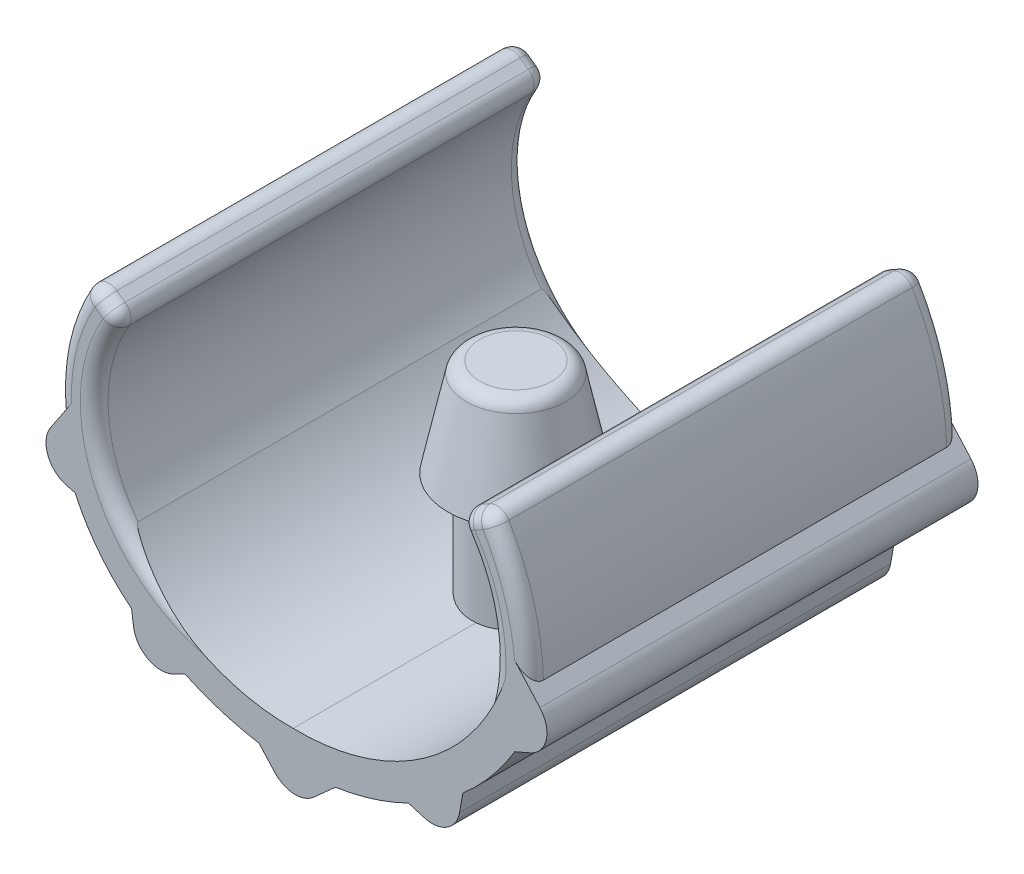
from build123d import *

# Parameters (mm, degrees)
BOSS_EXTRUDE2_DEPTH      = 438
SCALE2_SCALE             = 0.0354
FILLET1_R                = 1
FILLET3_R                = 0.5
BOSS_EXTRUDE4_REACH      = 229.046
BOSS_EXTRUDE4_END_RADIUS = 7.833804903539409
BOSS_EXTRUDE5_REACH      = 229.046
BOSS_EXTRUDE5_END_RADIUS = 7.195916772354179
SKETCH9_R                = 2.4500000000000166
BOSS_EXTRUDE6_DEPTH      = 3.5
BOSS_EXTRUDE6_TAPER      = 12.000000000000027
FILLET4_R                = 0.5
FILLET5_R                = 0.5


with BuildPart() as part:
    # Sketch1 → Boss-Extrude2 (new body)
    with BuildSketch(Plane.XY):
        with BuildLine():
            Line((-173.94944488422587, 133.04893483641976), (-205.55757114517837, 155.72039241042245))
            ThreePointArc((-205.55757114517837, 155.72039241042245), (-234.14291759319866, 90.65435185474743), (-237.99856948063464, 19.690659633520692))
            Line((-237.99856948063464, 19.690659633520692), (-268.78560446228477, -26.37000218418542))
            Line((-268.78560446228477, -26.37000218418542), (-221.58334196654945, -38.0173137091073))
            ThreePointArc((-221.58334196654945, -38.0173137091073), (-197.25445069634355, -77.98900365041848), (-164.25104188106897, -111.16137097284042))
            Line((-164.25104188106897, -111.16137097284042), (-156.91020046510585, -164.92082999803867))
            Line((-156.91020046510585, -164.92082999803867), (-109.83694304552782, -141.76430329216726))
            ThreePointArc((-109.83694304552782, -141.76430329216726), (-73.05463931342217, -155.90344513018698), (-34.693982777046784, -164.92082999802741))
            Line((-34.693982777046784, -164.92082999802741), (8.7e-16, -203.32876962147174))
            Line((8.7e-16, -203.32876962147174), (42.886528299507454, -164.92082999803867))
            ThreePointArc((42.886528299507454, -164.92082999803867), (80.85031694587045, -156.15581480317226), (117.0574866250999, -141.76430329216527))
            Line((117.0574866250999, -141.76430329216527), (163.62663007317934, -155.5211020358426))
            Line((163.62663007317934, -155.5211020358426), (172.33489452773424, -105.31526123343045))
            ThreePointArc((172.33489452773424, -105.31526123343045), (201.26999586949904, -76.00180070121596), (225.16207447857465, -42.45053190598781))
            Line((225.16207447857465, -42.45053190598781), (276.7091620785597, -20.09552082246478))
            Line((276.7091620785597, -20.09552082246478), (240.13220907166487, 20.928394745859066))
            ThreePointArc((240.13220907166487, 20.928394745859066), (228.50333628815278, 91.31530648405399), (197.81892765652609, 155.72039241042245))
            Line((197.81892765652609, 155.72039241042245), (163.62663007317934, 136.78068958284211))
            ThreePointArc((163.62663007317934, 136.78068958284211), (200.40161641541866, 53.04108317489744), (188.74891280313733, -37.672398735751855))
            ThreePointArc((188.74891280313733, -37.672398735751855), (106.72957881975618, -110.16481840277211), (0, -134.4777586037073))
            ThreePointArc((0, -134.4777586037073), (-97.14653243858214, -111.81017845437619), (-171.81116977095917, -45.655360892149815))
            ThreePointArc((-171.81116977095917, -45.655360892149815), (-202.2026421094417, 43.34593240273995), (-173.94944488422587, 133.04893483641976))
        make_face()
    extrude(amount=BOSS_EXTRUDE2_DEPTH)


with BuildPart() as part_1:
    # Scale2: scaled about (-0.803531763, -44.538090577, 219)
    add(part.part.scale(SCALE2_SCALE).moved(Location((-0.7750867385897999, -42.9614421705742, 211.2474))))

    # Fillet1
    fillet1_edges = [part_1.edges().sort_by_distance(p)[0] for p in [
        (9.020417598991212, -43.67282360768945, 219),
        (5.017295966000749, -48.46688918264303, 219),
        (-0.7750867385897999, -50.1592806151743, 219),
        (-6.329707835054547, -48.79963955250477, 219),
        (-10.290097136554682, -43.89494024789437, 219),
    ]]
    fillet(fillet1_edges, radius=FILLET1_R)

    # Fillet3
    fillet3_edges = [part_1.edges().sort_by_distance(p)[0] for p in [
        (5.017295966000749, -38.11940575934159, 219),
        (6.227703300451223, -37.44894027924525, 219),
        (-8.051824757129115, -37.44894027924525, 219),
        (-6.932897087491397, -38.25150987736494, 219),
    ]]
    fillet(fillet3_edges, radius=FILLET3_R)

    # Boss-Extrude4: up to this cylinder (the profile starts inside it)
    boss_extrude4_end = Plane(origin=(-0.5718782122733226, -39.8907859748304, 218.5826), z_dir=(0, 0, -1)) * Cylinder(BOSS_EXTRUDE4_END_RADIUS, 474.7596098070788, mode=Mode.PRIVATE)
    # Sketch5 → Boss-Extrude4 (add, up to the surface)
    with BuildSketch(Plane(origin=(4.93e-15, -43.92195482510527, 0), x_dir=(-1, 0, 0), z_dir=(0, -1, 0)), mode=Mode.PRIVATE) as boss_extrude4_sk1:
        with BuildLine():
            Line((2.4830433835215895, -218.9766325943123), (2.4830433835215895, -218.18856740568762))
            ThreePointArc((2.4830433835215895, -218.18856740568762), (-0.6676784853573625, -218.58259999999996), (2.4830433835215895, -218.9766325943123))
        make_face()
    boss_extrude4_tool1 = extrude(boss_extrude4_sk1.sketch, amount=BOSS_EXTRUDE4_REACH, mode=Mode.PRIVATE) & boss_extrude4_end
    add(boss_extrude4_tool1.solids().sort_by_distance((-0.927234, -43.921955, 218.5826))[0])

    # Boss-Extrude5: up to this cylinder (the profile starts inside it)
    boss_extrude5_end = Plane(origin=(-0.909438988805693, -40.527292382187355, 218.5826), z_dir=(0, 0, -1)) * Cylinder(BOSS_EXTRUDE5_END_RADIUS, 473.4838335447083, mode=Mode.PRIVATE)
    # Sketch8 → Boss-Extrude5 (add, up to the surface)
    with BuildSketch(Plane(origin=(4.93e-15, -43.92195482510527, 0), x_dir=(-1, 0, 0), z_dir=(0, -1, 0)), mode=Mode.PRIVATE) as boss_extrude5_sk1:
        with BuildLine():
            Line((0.9323215146426276, -216.9826), (0.9323215146426278, -220.18259999999995))
            ThreePointArc((0.9323215146426278, -220.18259999999995), (2.5323215146426223, -218.58259999999996), (0.9323215146426276, -216.9826))
        make_face()
    boss_extrude5_tool1 = extrude(boss_extrude5_sk1.sketch, amount=BOSS_EXTRUDE5_REACH, mode=Mode.PRIVATE) & boss_extrude5_end
    add(boss_extrude5_tool1.solids().sort_by_distance((-1.611383, -43.921955, 218.5826))[0])

    # Sketch9 → Boss-Extrude6 (add)
    with BuildSketch(Plane(origin=(0, -43.92195482510527, 0), x_dir=(1, 0, 0), z_dir=(0, 1, 0))):
        with Locations((-0.9323215146426234, -218.58259999999996)):
            Circle(SKETCH9_R)
    extrude(amount=BOSS_EXTRUDE6_DEPTH, taper=BOSS_EXTRUDE6_TAPER)

    # Fillet4
    fillet4_edges = [part_1.edges().sort_by_distance(p)[0] for p in [
        (-2.63837354879756, -40.42195482510527, 218.58259999999996),
    ]]
    fillet(fillet4_edges, radius=FILLET4_R)

    # Fillet5
    # the kernel refuses this fillet: 0.5 mm, written as the material it takes off along each edge
    with BuildSketch(Plane(origin=(-7.3217616019139315, -37.97259029611609, 226.75259999999997), x_dir=(-0.5828410448445791, -0.8125861901635294, 0), z_dir=(-0.8125861901635294, 0.5828410448445791, 0))) as fillet5_piece_1:
        with BuildLine():
            CenterArc((FILLET5_R, -FILLET5_R), FILLET5_R, 90, 90)
            Line((-1.04e-15, -FILLET5_R), (0, 0))
            Line((0, 0), (FILLET5_R, 0))
        make_face()
    extrude(amount=0.3636755048877642, mode=Mode.SUBTRACT)
    with BuildSketch(Plane(origin=(-2.222841997345296, -41.383728471589215, 211.2474), x_dir=(-0.8703618288951374, 0.4924127199842747, 0), z_dir=(0.4924127199842747, 0.8703618288951374, 0))) as fillet5_piece_2_section:
        with BuildLine():
            CenterArc((7.032751817920667 - FILLET5_R, FILLET5_R), FILLET5_R, 270, 90)
            Line((7.03275181792067, FILLET5_R), (7.032751817920667, 0))
            Line((7.032751817920667, 0), (7.032751817920667 - FILLET5_R, 0))
        make_face()
    fillet5_piece_2 = revolve(axis=Axis((-2.222841997345296, -41.383728471589215, 211.2474), (0, 0, 1)), revolution_arc=46.87735831294304, mode=Mode.PRIVATE)
    fillet5_piece_2 = split(fillet5_piece_2, bisect_by=Plane(origin=(-6.638744674472937, -38.43213062581033, 211.2474), z_dir=(-0.8313838495271342, 0.555698564642238, 0)), keep=Keep.TOP, mode=Mode.PRIVATE)
    add(fillet5_piece_2, mode=Mode.SUBTRACT)
    with BuildSketch(Plane(origin=(0.32885461555361095, -41.94642319372326, 211.2474), x_dir=(0.8287837428916393, 0.5595690373122207, 0), z_dir=(-0.5595690373122207, 0.8287837428916393, 0))) as fillet5_piece_3_section:
        with BuildLine():
            CenterArc((6.0520694592547315 + FILLET5_R, -FILLET5_R), FILLET5_R, 90, 90)
            Line((6.0520694592547315, -FILLET5_R), (6.0520694592547315, 0))
            Line((6.0520694592547315, 0), (6.0520694592547315 + FILLET5_R, 0))
        make_face()
    fillet5_piece_3 = revolve(axis=Axis((0.32885461555361095, -41.94642319372326, 211.2474), (0, 0, -1)), revolution_arc=68.69623330129464, mode=Mode.PRIVATE)
    fillet5_piece_3 = fillet5_piece_3 & Plane(origin=(-0.5718782121867003, -39.89078597487058, 211.2474), x_dir=(0.8269931491274296, -0.5622119985346248, 0), z_dir=(0, 0, -1)) * Cylinder(7.833804903539417, 27, mode=Mode.PRIVATE)
    add(fillet5_piece_3, mode=Mode.SUBTRACT)
    with BuildSketch(Plane(origin=(5.8127153150509905, -37.67880927536456, 211.2474), x_dir=(0.4845474084832911, -0.8747650021189273, 0), z_dir=(-0.8747650021189273, -0.48454740848329114, 0))) as fillet5_piece_4:
        with BuildLine():
            CenterArc((FILLET5_R, FILLET5_R), FILLET5_R, 180, 90)
            Line((-5.79e-15, FILLET5_R), (0, 0))
            Line((0, 0), (FILLET5_R, 0))
        make_face()
    extrude(amount=0.3382459893744765, mode=Mode.SUBTRACT)
    with BuildSketch(Plane(origin=(6.054989019292634, -38.116191776424024, 211.2474), x_dir=(-0.48454740848328376, 0.8747650021189313, 0), z_dir=(-0.8747650021189313, -0.48454740848328376, 0))) as fillet5_piece_5:
        with BuildLine():
            CenterArc((0.5000000000000022 - FILLET5_R, -FILLET5_R), FILLET5_R, 0, 90)
            Line((0.49999999999999734, -FILLET5_R), (0.5000000000000022, 0))
            Line((0.5000000000000022, 0), (0.5000000000000022 - FILLET5_R, 0))
        make_face()
    revolve(axis=Axis((6.054989019292634, -38.116191776424024, 211.2474), (0, 0, -1)), revolution_arc=88.56241548700423, mode=Mode.SUBTRACT)
    with BuildSketch(Plane(origin=(5.759103265680751, -38.2800879940053, 211.2474), x_dir=(-0.8287837428916521, -0.5595690373122013, 0), z_dir=(0.5595690373122013, -0.8287837428916521, 0))) as fillet5_piece_6:
        with BuildLine():
            CenterArc((0.5000000000000004 - FILLET5_R, -FILLET5_R), FILLET5_R, 0, 90)
            Line((0.5000000000000012, -FILLET5_R), (0.5000000000000004, 0))
            Line((0.5000000000000004, 0), (0.5000000000000004 - FILLET5_R, 0))
        make_face()
    revolve(axis=Axis((5.759103265680751, -38.2800879940053, 211.2474), (0, 0, -1)), revolution_arc=95.04317493858562, mode=Mode.SUBTRACT)
    with BuildSketch(Plane(origin=(-7.908699817308769, -38.16691837994469, 211.2474), x_dir=(-0.8703618288951306, 0.4924127199842868, 0), z_dir=(-0.4924127199842868, -0.8703618288951306, 0))) as fillet5_piece_7:
        with BuildLine():
            CenterArc((0.5000000000000004 - FILLET5_R, -FILLET5_R), FILLET5_R, 0, 90)
            Line((0.5000000000000039, -FILLET5_R), (0.5000000000000004, 0))
            Line((0.5000000000000004, 0), (0.5000000000000004 - FILLET5_R, 0))
        make_face()
    revolve(axis=Axis((-7.908699817308769, -38.16691837994469, 211.2474), (0, 0, -1)), revolution_arc=96.15132931169192, mode=Mode.SUBTRACT)
    with BuildSketch(Plane(origin=(-7.613182124336225, -38.37888339119785, 211.2474), x_dir=(0.5828410448445934, 0.812586190163519, 0), z_dir=(-0.812586190163519, 0.5828410448445934, 0))) as fillet5_piece_8:
        with BuildLine():
            CenterArc((0.4999999999999974 - FILLET5_R, -FILLET5_R), FILLET5_R, 0, 90)
            Line((0.4999999999999974, -FILLET5_R), (0.4999999999999974, 0))
            Line((0.4999999999999974, 0), (0.4999999999999974 - FILLET5_R, 0))
        make_face()
    revolve(axis=Axis((-7.613182124336225, -38.37888339119785, 211.2474), (0, 0, -1)), revolution_arc=85.08742679291215, mode=Mode.SUBTRACT)
    with BuildSketch(Plane(origin=(5.8127153150509905, -37.67880927536456, 226.75259999999997), x_dir=(0.4845474084832911, -0.8747650021189273, 0), z_dir=(-0.8747650021189273, -0.48454740848329114, 0))) as fillet5_piece_9:
        with BuildLine():
            CenterArc((FILLET5_R, -FILLET5_R), FILLET5_R, 90, 90)
            Line((-5.79e-15, -FILLET5_R), (0, 0))
            Line((0, 0), (FILLET5_R, 0))
        make_face()
    extrude(amount=0.3382459893744765, mode=Mode.SUBTRACT)
    with BuildSketch(Plane(origin=(0.32885461555361095, -41.94642319372326, 226.75259999999997), x_dir=(0.8287837428916393, 0.5595690373122207, 0), z_dir=(-0.5595690373122207, 0.8287837428916393, 0))) as fillet5_piece_10_section:
        with BuildLine():
            CenterArc((6.0520694592547315 + FILLET5_R, FILLET5_R), FILLET5_R, 180, 90)
            Line((6.052069459254732, FILLET5_R), (6.0520694592547315, 0))
            Line((6.0520694592547315, 0), (6.0520694592547315 + FILLET5_R, 0))
        make_face()
    fillet5_piece_10 = revolve(axis=Axis((0.32885461555361095, -41.94642319372326, 226.75259999999997), (0, 0, -1)), revolution_arc=68.6962333012946, mode=Mode.PRIVATE)
    fillet5_piece_10 = fillet5_piece_10 & Plane(origin=(-0.5718782121867003, -39.89078597487058, 226.75259999999997), x_dir=(0.8269931491274296, -0.5622119985346248, 0), z_dir=(0, 0, -1)) * Cylinder(7.833804903539417, 27, mode=Mode.PRIVATE)
    add(fillet5_piece_10, mode=Mode.SUBTRACT)
    with BuildSketch(Plane(origin=(-2.222841997345296, -41.383728471589215, 226.75259999999997), x_dir=(-0.8703618288951374, 0.4924127199842747, 0), z_dir=(0.4924127199842747, 0.8703618288951374, 0))) as fillet5_piece_11_section:
        with BuildLine():
            CenterArc((7.032751817920667 - FILLET5_R, -FILLET5_R), FILLET5_R, 0, 90)
            Line((7.03275181792067, -FILLET5_R), (7.032751817920667, 0))
            Line((7.032751817920667, 0), (7.032751817920667 - FILLET5_R, 0))
        make_face()
    fillet5_piece_11 = revolve(axis=Axis((-2.222841997345296, -41.383728471589215, 226.75259999999997), (0, 0, 1)), revolution_arc=46.87735831294304, mode=Mode.PRIVATE)
    fillet5_piece_11 = split(fillet5_piece_11, bisect_by=Plane(origin=(-6.638744674472937, -38.43213062581033, 226.75259999999997), z_dir=(-0.8313838495271342, 0.555698564642238, 0)), keep=Keep.TOP, mode=Mode.PRIVATE)
    add(fillet5_piece_11, mode=Mode.SUBTRACT)
    with BuildSketch(Plane(origin=(6.054989019292634, -38.116191776424024, 226.75259999999997), x_dir=(-0.48454740848328376, 0.8747650021189313, 0), z_dir=(-0.8747650021189313, -0.48454740848328376, 0))) as fillet5_piece_12:
        with BuildLine():
            CenterArc((0.5000000000000022 - FILLET5_R, FILLET5_R), FILLET5_R, 270, 90)
            Line((0.49999999999999734, FILLET5_R), (0.5000000000000022, 0))
            Line((0.5000000000000022, 0), (0.5000000000000022 - FILLET5_R, 0))
        make_face()
    revolve(axis=Axis((6.054989019292634, -38.116191776424024, 226.75259999999997), (0, 0, -1)), revolution_arc=88.56241548700423, mode=Mode.SUBTRACT)
    with BuildSketch(Plane(origin=(5.759103265680751, -38.2800879940053, 226.75259999999997), x_dir=(-0.8287837428916516, -0.5595690373122022, 0), z_dir=(0.5595690373122022, -0.8287837428916516, 0))) as fillet5_piece_13:
        with BuildLine():
            CenterArc((0.5000000000000006 - FILLET5_R, FILLET5_R), FILLET5_R, 270, 90)
            Line((0.5000000000000006, FILLET5_R), (0.5000000000000006, 0))
            Line((0.5000000000000006, 0), (0.5000000000000006 - FILLET5_R, 0))
        make_face()
    revolve(axis=Axis((5.759103265680751, -38.2800879940053, 226.75259999999997), (0, 0, -1)), revolution_arc=95.04317493858578, mode=Mode.SUBTRACT)
    with BuildSketch(Plane(origin=(-7.908699817308769, -38.16691837994469, 226.75259999999997), x_dir=(-0.8703618288951306, 0.4924127199842868, 0), z_dir=(-0.4924127199842868, -0.8703618288951306, 0))) as fillet5_piece_14:
        with BuildLine():
            CenterArc((0.5000000000000004 - FILLET5_R, FILLET5_R), FILLET5_R, 270, 90)
            Line((0.5000000000000039, FILLET5_R), (0.5000000000000004, 0))
            Line((0.5000000000000004, 0), (0.5000000000000004 - FILLET5_R, 0))
        make_face()
    revolve(axis=Axis((-7.908699817308769, -38.16691837994469, 226.75259999999997), (0, 0, -1)), revolution_arc=96.15132931169192, mode=Mode.SUBTRACT)
    with BuildSketch(Plane(origin=(-7.613182124336225, -38.37888339119785, 226.75259999999997), x_dir=(0.582841044844582, 0.8125861901635272, 0), z_dir=(-0.8125861901635272, 0.582841044844582, 0))) as fillet5_piece_15:
        with BuildLine():
            CenterArc((0.5000000000000021 - FILLET5_R, FILLET5_R), FILLET5_R, 270, 90)
            Line((0.5000000000000021, FILLET5_R), (0.5000000000000021, 0))
            Line((0.5000000000000021, 0), (0.5000000000000021 - FILLET5_R, 0))
        make_face()
    revolve(axis=Axis((-7.613182124336225, -38.37888339119785, 226.75259999999997), (0, 0, -1)), revolution_arc=85.08742679291261, mode=Mode.SUBTRACT)
    with BuildSketch(Plane(origin=(-1.2929200299765795, -42.43070336340494, 211.2474), x_dir=(0.9933629903397296, -0.11502160415900238, 0), z_dir=(-0.11502160415900238, -0.9933629903397296, 0))) as fillet5_piece_16_section:
        with BuildLine():
            CenterArc((9.020961074346305 - FILLET5_R, FILLET5_R), FILLET5_R, 270, 90)
            Line((9.020961074346305, FILLET5_R), (9.020961074346305, 0))
            Line((9.020961074346305, 0), (9.020961074346305 - FILLET5_R, 0))
        make_face()
    fillet5_piece_16 = revolve(axis=Axis((-1.2929200299765795, -42.43070336340494, 211.2474), (0, 0, 1)), revolution_arc=37.025279758983544, mode=Mode.PRIVATE)
    fillet5_piece_16 = split(fillet5_piece_16, bisect_by=Plane(origin=(3.835831623021377, -37.85790465326453, 211.2474), z_dir=(0.7464033799962542, 0.6654937973641584, 0)), keep=Keep.TOP, mode=Mode.PRIVATE)
    add(fillet5_piece_16, mode=Mode.SUBTRACT)
    with BuildSketch(Plane(origin=(-2.594746622639068, -41.36312090427482, 211.2474), x_dir=(-0.22024662683485344, -0.9754442184809282, 0), z_dir=(0.9754442184809282, -0.22024662683485344, 0))) as fillet5_piece_17:
        with BuildLine():
            CenterArc((5.33869578066457 + FILLET5_R, -FILLET5_R), FILLET5_R, 90, 90)
            Line((5.338695780664571, -FILLET5_R), (5.33869578066457, 0))
            Line((5.33869578066457, 0), (5.33869578066457 + FILLET5_R, 0))
        make_face()
    revolve(axis=Axis((-2.594746622639068, -41.36312090427482, 211.2474), (0, 0, -1)), revolution_arc=108.01452351604581, mode=Mode.SUBTRACT)
    with BuildSketch(Plane(origin=(-2.594746622639068, -41.36312090427482, 226.75259999999997), x_dir=(-0.22024662683485344, -0.9754442184809282, 0), z_dir=(0.9754442184809282, -0.22024662683485344, 0))) as fillet5_piece_18:
        with BuildLine():
            CenterArc((5.33869578066457 + FILLET5_R, FILLET5_R), FILLET5_R, 180, 90.00000000000068)
            Line((5.33869578066457 + FILLET5_R, 0), (5.33869578066457, 0))
            Line((5.33869578066457, 0), (5.338695780664571, FILLET5_R))
        make_face()
    revolve(axis=Axis((-2.594746622639068, -41.36312090427482, 226.75259999999997), (0, 0, -1)), revolution_arc=108.01452351604581, mode=Mode.SUBTRACT)
    with BuildSketch(Plane(origin=(-1.2929200299765795, -42.43070336340494, 226.75259999999997), x_dir=(0.9933629903397296, -0.11502160415900238, 0), z_dir=(-0.11502160415900238, -0.9933629903397296, 0))) as fillet5_piece_19_section:
        with BuildLine():
            CenterArc((9.020961074346305 - FILLET5_R, -FILLET5_R), FILLET5_R, 0, 90)
            Line((9.020961074346305, -FILLET5_R), (9.020961074346305, 0))
            Line((9.020961074346305, 0), (9.020961074346305 - FILLET5_R, 0))
        make_face()
    fillet5_piece_19 = revolve(axis=Axis((-1.2929200299765795, -42.43070336340494, 226.75259999999997), (0, 0, 1)), revolution_arc=37.025279758983544, mode=Mode.PRIVATE)
    fillet5_piece_19 = split(fillet5_piece_19, bisect_by=Plane(origin=(3.835831623021377, -37.85790465326453, 226.75259999999997), z_dir=(0.7464033799962542, 0.6654937973641584, 0)), keep=Keep.TOP, mode=Mode.PRIVATE)
    add(fillet5_piece_19, mode=Mode.SUBTRACT)
    with BuildSketch(Plane(origin=(-7.3217616019139315, -37.972590296116095, 211.2474), x_dir=(-0.5828410448445791, -0.8125861901635294, 0), z_dir=(-0.8125861901635294, 0.5828410448445791, 0))) as fillet5_piece_20:
        with BuildLine():
            CenterArc((FILLET5_R, FILLET5_R), FILLET5_R, 180, 90)
            Line((-1.04e-15, FILLET5_R), (0, 0))
            Line((0, 0), (FILLET5_R, 0))
        make_face()
    extrude(amount=0.36367550488776834, mode=Mode.SUBTRACT)


solid = part_1.part
